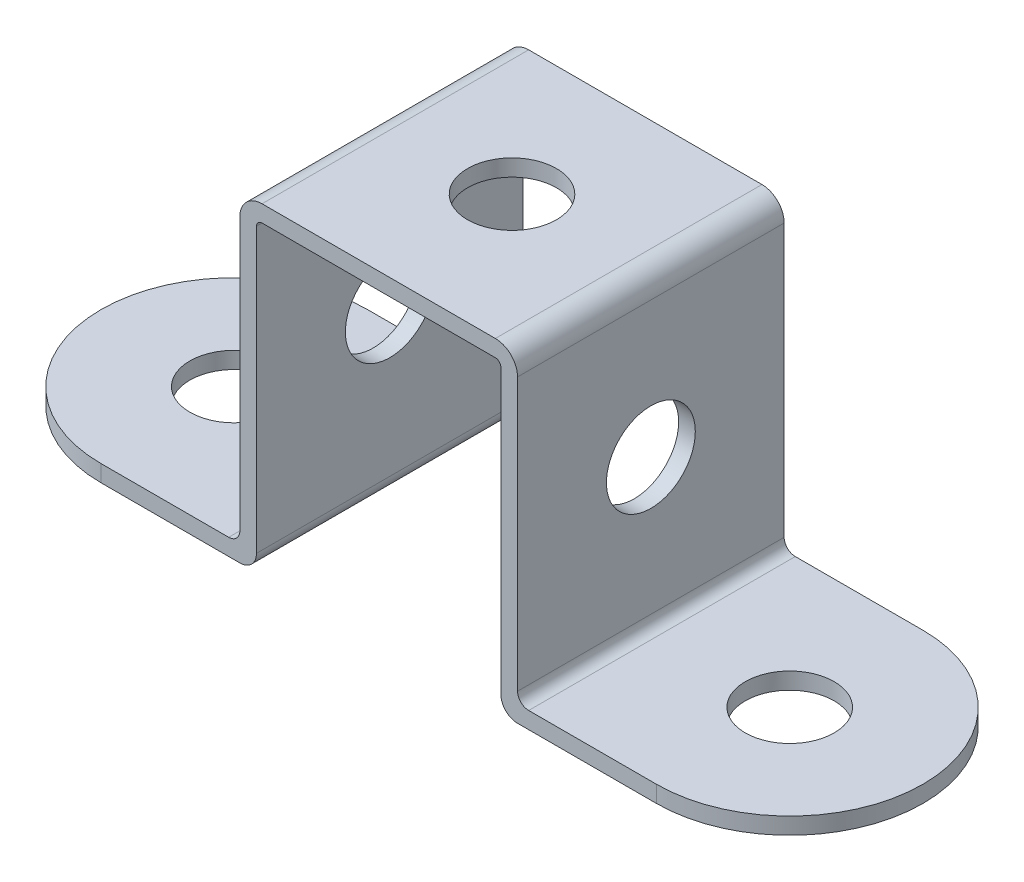
from build123d import *

# Parameters (mm, degrees)
ESTRUSIONE_SOTTILE1_DEPTH    = 6
RACCORDO3_R                  = 6
SCHIZZO4_R                   = 2
TAGLIO_ESTRUSIONE1_DEPTH     = 0.75
RACCORDO1_R                  = 0.75
RACCORDO2_R                  = 0.5
TAGLIO_ESTRUSIONE2_DEPTH     = 0.75
SCHIZZO6_R                   = 2
ESTRUSIONE_ESTRUSIONE1_DEPTH = 0.75
ESTRUSIONE_ESTRUSIONE3_DEPTH = 6
RACCORDO3_OF_SPECCHIA2_R     = 6
RACCORDO1_OF_SPECCHIA2_R     = 0.75
RACCORDO2_OF_SPECCHIA2_R     = 0.5
SCHIZZO8_R                   = 2
TAGLIO_ESTRUSIONE3_DEPTH     = 0.75
SCHIZZO9_R                   = 2
TAGLIO_ESTRUSIONE4_DEPTH     = 19


with BuildPart() as part:
    # Schizzo1 → Estrusione-Sottile1 (new, symmetric)
    with BuildSketch(Plane.XY):
        Polygon((0, 13), (0, 0), (-11, 0), (-11, 0.75), (-0.75, 0.75), (-0.75, 13), align=None)
    estrusione_sottile1 = extrude(amount=ESTRUSIONE_SOTTILE1_DEPTH, both=True)

    # Raccordo3
    raccordo3_edges = [part.edges().sort_by_distance(p)[0] for p in [
        (-11, 0.375, 6),
        (-11, 0.375, -6),
        (-0.375, 13, -6),
        (-0.375, 13, 6),
    ]]
    fillet(raccordo3_edges, radius=RACCORDO3_R - 0.0001)  # a hair under: the kernel refuses the full size

    # Schizzo4 → Taglio-Estrusione1 (cut)
    with BuildSketch(Plane(origin=(0, 0.75, 0), x_dir=(1, 0, 0), z_dir=(0, 1, 0))):
        with Locations(Location((-7, 0, 0), (0, 0, 180))):
            Circle(SCHIZZO4_R)
    taglio_estrusione1 = extrude(amount=-TAGLIO_ESTRUSIONE1_DEPTH, mode=Mode.SUBTRACT)

    # Raccordo1
    raccordo1_edges = [part.edges().sort_by_distance(p)[0] for p in [
        (0, 0, 0),
    ]]
    fillet(raccordo1_edges, radius=RACCORDO1_R)

    # Raccordo2
    raccordo2_edges = [part.edges().sort_by_distance(p)[0] for p in [
        (-0.75, 0.75, 0),
    ]]
    fillet(raccordo2_edges, radius=RACCORDO2_R)

    # Schizzo5 → Taglio-Estrusione2 (cut)
    with BuildSketch(Plane.ZY.offset(0.75)):
        with BuildLine():
            Line((2, 9), (2, 3.5))
            ThreePointArc((2, 3.5), (0, 1.5), (-2, 3.5))
            Line((-2, 3.5), (-2, 9))
            ThreePointArc((-2, 9), (0, 11), (2, 9))
        make_face()
    extrude(amount=-TAGLIO_ESTRUSIONE2_DEPTH, mode=Mode.SUBTRACT)

    # Schizzo6 → Estrusione-Estrusione1 (add)
    with BuildSketch(Plane(origin=(0, 0.75, 0), x_dir=(1, 0, 0), z_dir=(0, 1, 0))):
        with BuildLine():
            Line((-4.125, -6), (-7, -6))
            ThreePointArc((-7, -6), (-13, 0), (-7, 6))
            Line((-7, 6), (-4.125, 6))
            Line((-4.125, 6), (-4.125, -6))
        make_face()
        with Locations(Location((-7, 0, 0), (0, 0, 180))):
            Circle(SCHIZZO6_R, mode=Mode.SUBTRACT)
    estrusione_estrusione1 = extrude(amount=-ESTRUSIONE_ESTRUSIONE1_DEPTH)

    # Schizzo7 → Estrusione-Estrusione3 (add, symmetric)
    with BuildSketch(Plane.XY):
        with BuildLine():
            Line((-0.75, 13), (-0.75, 7))
            Line((-0.75, 7), (-0.75, 1.25))
            ThreePointArc((-0.75, 1.25), (-0.896446609, 0.896446609), (-1.25, 0.75))
            Line((-1.25, 0.75), (-4.125, 0.75))
            Line((-4.125, 0.75), (-4.125, 0))
            Line((-4.125, 0), (-0.75, 0))
            ThreePointArc((-0.75, 0), (-0.219669914, 0.219669914), (0, 0.75))
            Line((0, 0.75), (0, 7))
            Line((0, 7), (0, 13))
            Line((0, 13), (0, 13.5))
            ThreePointArc((0, 13.5), (0.073223305, 13.676776695), (0.25, 13.75))
            Line((0.25, 13.75), (5.5, 13.75))
            Line((5.5, 13.75), (5.5, 14.5))
            Line((5.5, 14.5), (0.25, 14.5))
            ThreePointArc((0.25, 14.5), (-0.457106781, 14.207106781), (-0.75, 13.5))
            Line((-0.75, 13.5), (-0.75, 13))
        make_face()
    estrusione_estrusione3 = extrude(amount=ESTRUSIONE_ESTRUSIONE3_DEPTH, both=True)


with BuildPart() as specchia2_1:
    # Specchia2: Estrusione-Sottile1 across plane
    add(estrusione_sottile1.mirror(Plane(origin=(5.5, 14.5, 6), x_dir=(0, 0, 1), z_dir=(-1, 0, 0))))

    # Specchia2 2: Taglio-Estrusione1 across plane
    add(taglio_estrusione1.mirror(Plane(origin=(5.5, 14.5, 6), x_dir=(0, 0, 1), z_dir=(-1, 0, 0))), mode=Mode.SUBTRACT)

    # Raccordo3 of Specchia2
    raccordo3_of_specchia2_edges = [specchia2_1.edges().sort_by_distance(p)[0] for p in [
        (22, 0.375, 6),
        (22, 0.375, -6),
        (11.375, 13, -6),
        (11.375, 13, 6),
    ]]
    fillet(raccordo3_of_specchia2_edges, radius=RACCORDO3_OF_SPECCHIA2_R - 0.0001)  # a hair under: the kernel refuses the full size

    # Raccordo1 of Specchia2
    raccordo1_of_specchia2_edges = [specchia2_1.edges().sort_by_distance(p)[0] for p in [
        (11, 0, 0),
    ]]
    fillet(raccordo1_of_specchia2_edges, radius=RACCORDO1_OF_SPECCHIA2_R)

    # Raccordo2 of Specchia2
    raccordo2_of_specchia2_edges = [specchia2_1.edges().sort_by_distance(p)[0] for p in [
        (11.75, 0.75, 0),
    ]]
    fillet(raccordo2_of_specchia2_edges, radius=RACCORDO2_OF_SPECCHIA2_R)


with BuildPart() as specchia2_3_1:
    # Specchia2 3: Estrusione-Estrusione1, Estrusione-Estrusione3 across plane
    add(estrusione_estrusione1.mirror(Plane(origin=(5.5, 14.5, 6), x_dir=(0, 0, 1), z_dir=(-1, 0, 0))))
    add(estrusione_estrusione3.mirror(Plane(origin=(5.5, 14.5, 6), x_dir=(0, 0, 1), z_dir=(-1, 0, 0))))


with BuildPart() as part_1:
    add(part.part)

    # Specchia2 united with what the copies to: union Specchia2_1, Specchia2 3_1
    add(specchia2_1.part)
    add(specchia2_3_1.part)

    # Schizzo8 → Taglio-Estrusione3 (cut)
    with BuildSketch(Plane(origin=(0, 14.5, 0), x_dir=(1, 0, 0), z_dir=(0, 1, 0))):
        with Locations(Location((5.5, 0, 0), (0, 0, 270))):
            Circle(SCHIZZO8_R)
    extrude(amount=-TAGLIO_ESTRUSIONE3_DEPTH, mode=Mode.SUBTRACT)

    # Schizzo9 → Taglio-Estrusione4 (cut)
    with BuildSketch(Plane(origin=(11.75, 0, 0), x_dir=(0, 0, -1), z_dir=(1, 0, 0))):
        with Locations((0, 7.375)):
            Circle(SCHIZZO9_R)
    extrude(amount=-TAGLIO_ESTRUSIONE4_DEPTH, mode=Mode.SUBTRACT)


solid = part_1.part
